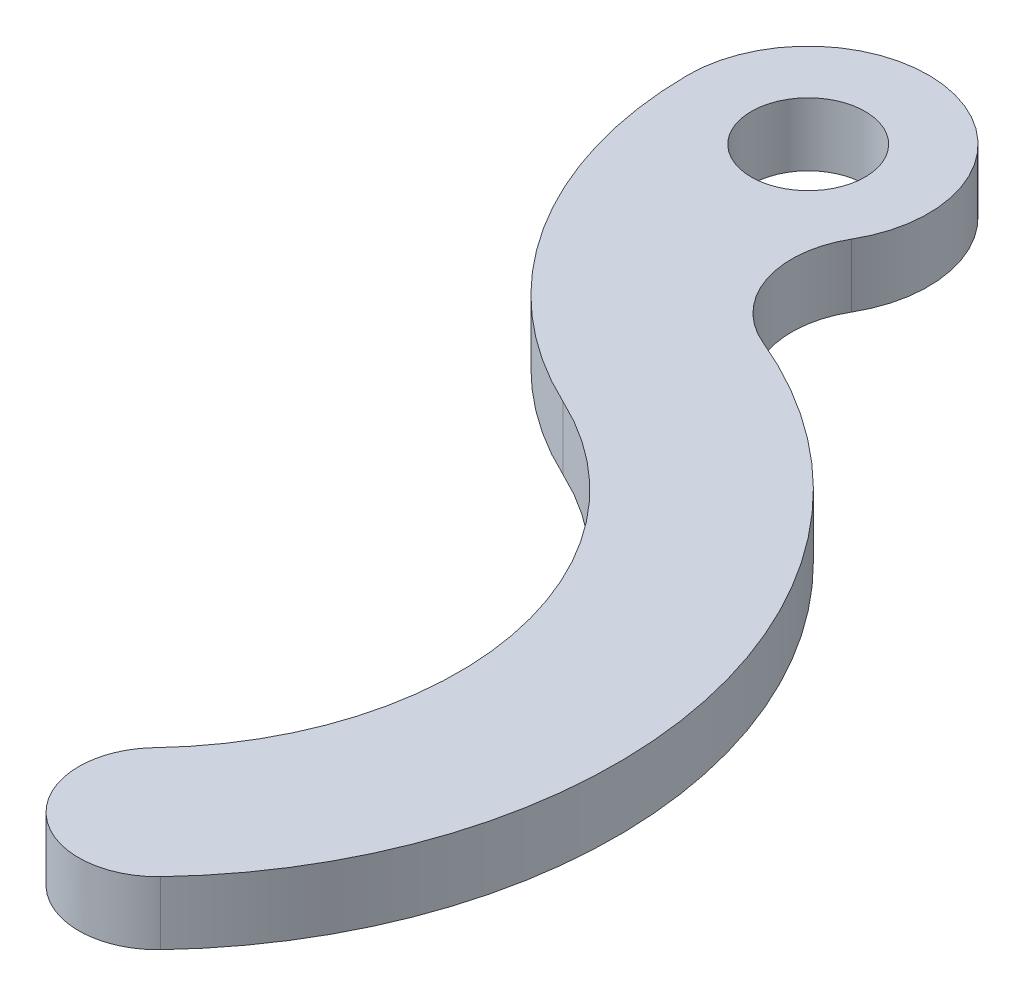
from build123d import *

# Parameters (mm, degrees)
SKETCH1_R           = 3.6
BOSS_EXTRUDE1_DEPTH = 4
FILLET1_DEPTH       = 4


with BuildPart() as part:
    # Sketch1 → Boss-Extrude1 (new body)
    with BuildSketch(Plane(origin=(0, 0, 0), x_dir=(1, 0, 0), z_dir=(0, 1, 0))):
        with BuildLine():
            Line((9.346086984, -56.356572977), (15.081851343, -64.548093422))
            ThreePointArc((15.081851343, -64.548093422), (27.699790534, -36.740032424), (9.415453774, -12.282238674))
            ThreePointArc((9.415453774, -12.282238674), (6.074212989, -8.697213495), (6.569252548, -3.821638518))
            ThreePointArc((6.569252548, -3.821638518), (1.956261977, 7.343911701), (-7.599852871, -0.04729001))
            ThreePointArc((-7.599852871, -0.04729001), (-3.773263774, -12.975309302), (6.3636811, -21.864562113))
            ThreePointArc((6.3636811, -21.864562113), (17.800210223, -38.250629299), (9.346086984, -56.356572977))
        make_face()
        with Locations(Location((0, 0, 0), (0, 0, 270))):
            Circle(SKETCH1_R, mode=Mode.SUBTRACT)
    extrude(amount=BOSS_EXTRUDE1_DEPTH)

    # Fillet1: read off the stored shape, not the designer's step
    # Fillet1 outline → Fillet1 (cut)
    with BuildSketch(Plane(origin=(0, 0, 0), x_dir=(1, 0, 0), z_dir=(0, 1, 0))):
        with BuildLine():
            ThreePointArc((15.081851343, -64.548093422), (17.464679897, -62.694164436), (19.649105693, -60.610127838))
            add(Edge.make_bspline(
                [(19.649105693, -60.610127838), (18.677855173, -61.634935456), (17.188222286, -62.496348841), (15.223722909, -62.743763995), (13.23213393, -61.906423138), (11.924254263, -60.03857744)],
                knots=[0, 0, 0, 0, 0, 0, 0.550510254, 0.550510254, 0.550510254, 0.550510254, 0.550510254, 0.550510254], degree=5, weights=[1, 0.779795898, 0.620204104, 0.521224619, 0.482857441, 0.505102571]))
            Line((11.924254263, -60.03857744), (15.081851343, -64.548093422))
        make_face()
        with BuildLine():
            Line((9.346086984, -56.356572977), (11.924254263, -60.03857744))
            add(Edge.make_bspline(
                [(11.924254263, -60.03857744), (10.93883994, -58.631259971), (10.675135711, -57.05607025), (10.993827945, -55.636809597), (11.636969564, -54.526791063), (12.390923216, -53.731262588)],
                knots=[0.550510254, 0.550510254, 0.550510254, 0.550510254, 0.550510254, 0.550510254, 1, 1, 1, 1, 1, 1], degree=5, weights=[0.505102571, 0.523265645, 0.581836924, 0.68081641, 0.820204102, 1]))
            ThreePointArc((12.390923216, -53.731262588), (10.934639353, -55.12062032), (9.346086984, -56.356572977))
        make_face()
    extrude(amount=FILLET1_DEPTH, mode=Mode.SUBTRACT)


solid = part.part
